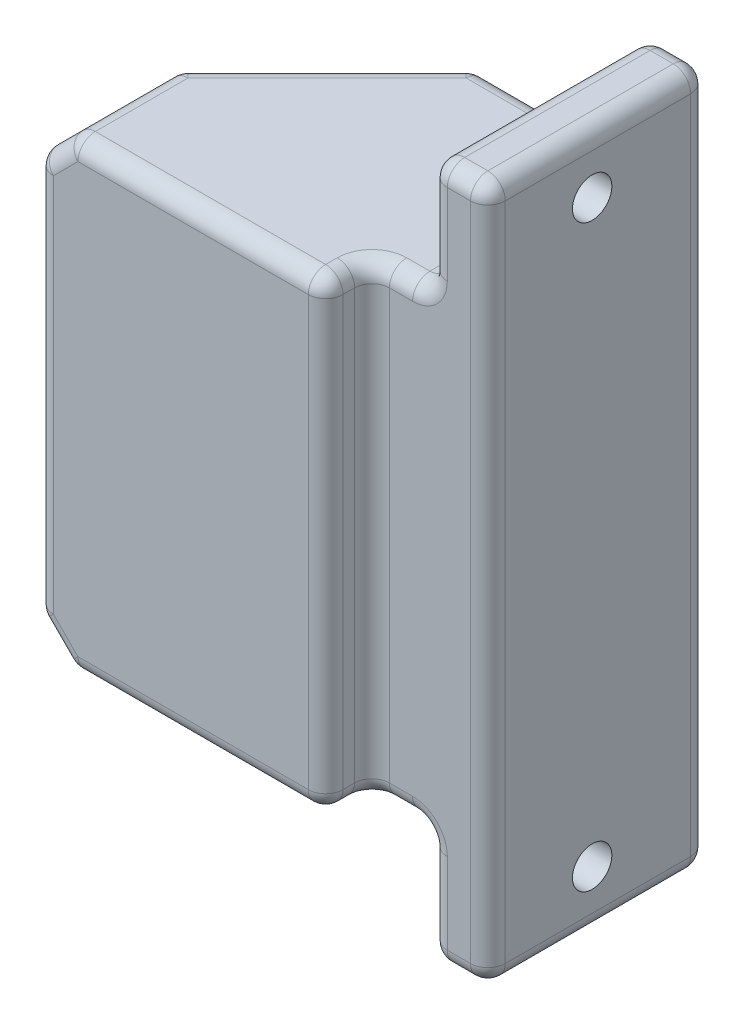
from build123d import *

# Parameters (mm, degrees)
SKETCH1_W                       = 20
SKETCH1_H                       = 40
SKETCH1_W_2                     = 5
BOSS_EXTRUDE1_DEPTH             = 20
SKETCH3_W                       = 25
SKETCH3_H                       = 40
BOSS_EXTRUDE2_DEPTH             = 3
CUT_EXTRUDE1_START              = -0.5
SKETCH2_R                       = 5.25
CUT_EXTRUDE1_DEPTH              = 12.2
MOVE_FACE1_BY                   = 5
MOVE_FACE1_2_BY                 = 5
CBORE_START                     = 30
CBORE_FOR_M3_SBHCS1_OUTLINE_R   = 3.35
CBORE_FOR_M3_SBHCS1_DEPTH       = 1.65
CBORE_START_2                   = 31.65
CBORE_FOR_M3_SBHCS1_2_OUTLINE_R = 1.7
CBORE_FOR_M3_SBHCS1_2_DEPTH     = 3.35
CHAMFER1_SIZE                   = 12
CHAMFER2_SIZE                   = 3
MOVE_FACE2_BY                   = 1
FILLET1_R                       = 1.5


# Read off the part's stored shape, not the designer's step: CBORE for M3 SBHCS1
with BuildPart() as part:
    # Sketch1 → Boss-Extrude1 (new body)
    with BuildSketch(Plane.XY):
        with Locations((10, 20)):
            Rectangle(SKETCH1_W, SKETCH1_H)
        with Locations((22.5, 20)):
            Rectangle(SKETCH1_W_2, SKETCH1_H)
        Polygon((25, 40), (25, 0), (25, -10), (35, -10), (35, 50), (25, 50), align=None)
    extrude(amount=BOSS_EXTRUDE1_DEPTH)

    # Sketch3 → Boss-Extrude2 (add)
    with BuildSketch(Plane.XY.offset(20)):
        with Locations((12.5, 20)):
            Rectangle(SKETCH3_W, SKETCH3_H)
    extrude(amount=BOSS_EXTRUDE2_DEPTH)

    # Sketch2 → Cut-Extrude1 (cut)
    with BuildSketch(Plane.XY.offset(23).offset(CUT_EXTRUDE1_START)):
        with Locations((10, 10)):
            Circle(SKETCH2_R)
        with Locations((10, 30)):
            Circle(SKETCH2_R)
    extrude(amount=-CUT_EXTRUDE1_DEPTH, mode=Mode.SUBTRACT)

    # Move Face1: a face moved inward by 5.0
    extrude(part.faces().sort_by_distance((25, -5, 10))[0], amount=MOVE_FACE1_BY, dir=(1, 0, 0), mode=Mode.SUBTRACT)

    # Move Face1 2: a face moved inward by 5.0
    extrude(part.faces().sort_by_distance((25, 45, 10))[0], amount=MOVE_FACE1_2_BY, dir=(1, 0, 0), mode=Mode.SUBTRACT)

    # CBORE for M3 SBHCS1 outline → CBORE for M3 SBHCS1 (cut)
    with BuildSketch(Plane.YZ.offset(CBORE_START)):
        with Locations((-5, 10)):
            Circle(CBORE_FOR_M3_SBHCS1_OUTLINE_R)
        with Locations((45, 10)):
            Circle(CBORE_FOR_M3_SBHCS1_OUTLINE_R)
    extrude(amount=CBORE_FOR_M3_SBHCS1_DEPTH, mode=Mode.SUBTRACT)

    # CBORE for M3 SBHCS1 2 outline → CBORE for M3 SBHCS1 2 (cut)
    with BuildSketch(Plane.YZ.offset(CBORE_START_2)):
        with Locations((-5, 10)):
            Circle(CBORE_FOR_M3_SBHCS1_2_OUTLINE_R)
        with Locations((45, 10)):
            Circle(CBORE_FOR_M3_SBHCS1_2_OUTLINE_R)
    extrude(amount=CBORE_FOR_M3_SBHCS1_2_DEPTH, mode=Mode.SUBTRACT)

    # Chamfer1
    chamfer1_edges = [part.edges().sort_by_distance(p)[0] for p in [
        (0, 20, 0),
    ]]
    chamfer(chamfer1_edges, length=CHAMFER1_SIZE)

    # Chamfer2
    chamfer2_edges = [part.edges().sort_by_distance(p)[0] for p in [
        (0, 0, 17.5),
        (0, 40, 17.5),
        (6, 40, 6),
        (6, 0, 6),
    ]]
    chamfer(chamfer2_edges, length=CHAMFER2_SIZE)

    # Move Face2: a face moved inward by 1.0
    extrude(part.faces().sort_by_distance((30.5, 20, 20))[0], amount=MOVE_FACE2_BY, dir=(0, 0, -1), mode=Mode.SUBTRACT)

    # Fillet1
    fillet1_edges = [part.edges().sort_by_distance(p)[0] for p in [
        (30, 45, 0),
        (32.5, 50, 0),
        (30, -5, 19),
        (35, 20, 0),
        (32.5, -10, 0),
        (30, -5, 0),
        (30, 40, 9.5),
        (30, 50, 9.5),
        (35, 50, 9.5),
        (35, -10, 9.5),
        (30, -10, 9.5),
        (30, 0, 9.5),
        (32.5, -10, 19),
        (35, 20, 19),
        (32.5, 50, 19),
        (25, 20, 19),
        (25, 0, 21),
        (25, 40, 21),
        (30, 45, 19),
        (25, 20, 23),
        (14, 40, 23),
        (27.5, 0, 19),
        (27.5, 40, 19),
        (23.121320344, 40, 0),
        (3, 40, 18.121320344),
        (9.621320344, 40, 6.621320344),
        (0, 20, 12),
        (12, 20, 0),
        (6, 3, 6),
        (6, 37, 6),
        (23.121320344, 0, 0),
        (14.121320344, 1.5, 0),
        (14.121320344, 38.5, 0),
        (0, 20, 23),
        (0, 3, 17.5),
        (0, 37, 17.5),
        (14, 0, 23),
        (1.5, 1.5, 23),
        (1.5, 38.5, 23),
        (3, 0, 18.121320344),
        (9.621320344, 0, 6.621320344),
        (1.5, 38.5, 12.621320344),
        (1.5, 1.5, 12.621320344),
    ]]
    fillet(fillet1_edges, radius=FILLET1_R)


solid = part.part
